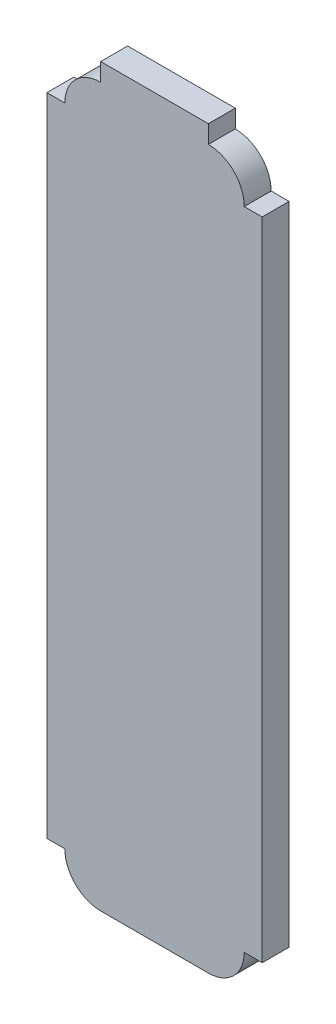
from build123d import *

# Parameters (mm, degrees)
SZKIC1_W                    = 10
SZKIC1_H                    = 40
DODANIE_WYCI_GNI_CIE1_DEPTH = 1.5
ZAOKR_GLENIE1_R             = 2
SZKIC2_W                    = 1.5
SZKIC2_H                    = 36
DODANIE_WYCI_GNI_CIE2_DEPTH = 1
SZKIC3_W                    = 1.5
SZKIC3_H                    = 36
DODANIE_WYCI_GNI_CIE3_DEPTH = 1
SZKIC4_W                    = 6
SZKIC4_H                    = 1.5
DODANIE_WYCI_GNI_CIE4_DEPTH = 1


with BuildPart() as part:
    # Szkic1 → Dodanie-wyciągnięcie1 (new body)
    with BuildSketch(Plane.XY):
        with Locations((5, 20)):
            Rectangle(SZKIC1_W, SZKIC1_H)
    extrude(amount=DODANIE_WYCI_GNI_CIE1_DEPTH)

    # Zaokrąglenie1
    zaokr_glenie1_edges = [part.edges().sort_by_distance(p)[0] for p in [
        (10, 0, 0.75),
        (0, 0, 0.75),
        (10, 40, 0.75),
        (0, 40, 0.75),
    ]]
    fillet(zaokr_glenie1_edges, radius=ZAOKR_GLENIE1_R)

    # Szkic2 → Dodanie-wyciągnięcie2 (add)
    with BuildSketch(Plane(origin=(10, 0, 0), x_dir=(0, 0, -1), z_dir=(1, 0, 0))):
        with Locations((-0.75, 20)):
            Rectangle(SZKIC2_W, SZKIC2_H)
    extrude(amount=DODANIE_WYCI_GNI_CIE2_DEPTH)

    # Szkic3 → Dodanie-wyciągnięcie3 (add)
    with BuildSketch(Plane.ZY):
        with Locations((0.75, 20)):
            Rectangle(SZKIC3_W, SZKIC3_H)
    extrude(amount=DODANIE_WYCI_GNI_CIE3_DEPTH)

    # Szkic4 → Dodanie-wyciągnięcie4 (add)
    with BuildSketch(Plane(origin=(0, 40, 0), x_dir=(1, 0, 0), z_dir=(0, 1, 0))):
        with Locations((5, -0.75)):
            Rectangle(SZKIC4_W, SZKIC4_H)
    extrude(amount=DODANIE_WYCI_GNI_CIE4_DEPTH)


solid = part.part
